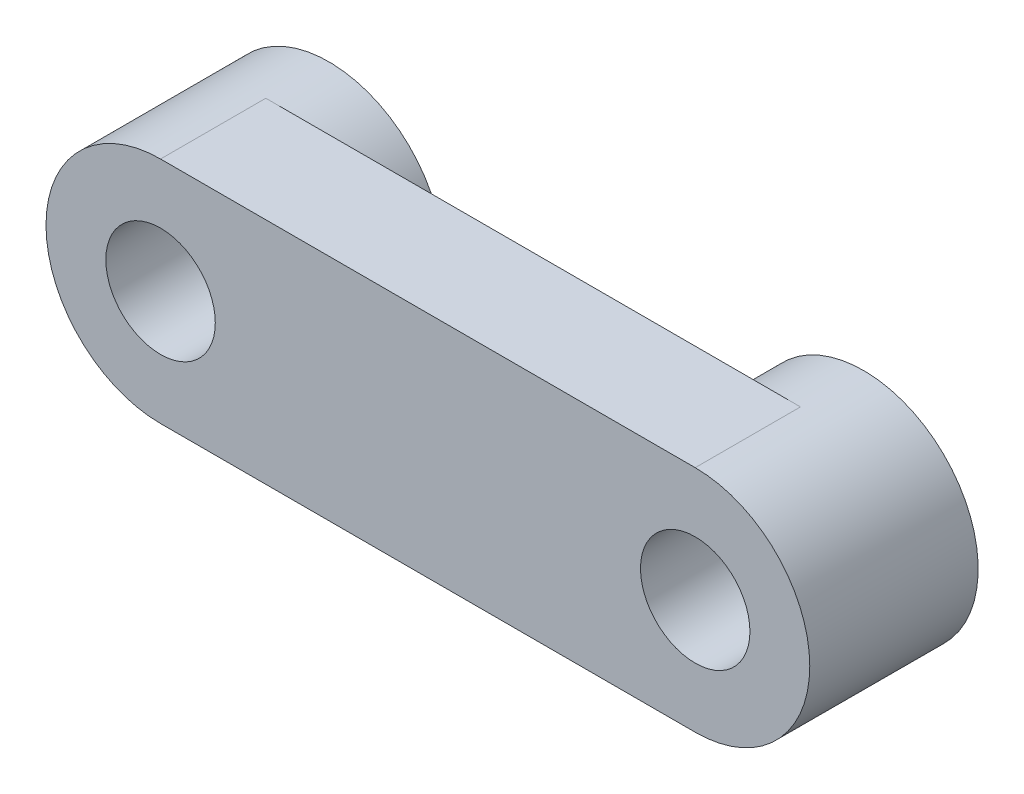
from build123d import *
from build123d.topology import SkipClean

# Parameters (mm, degrees)
SKETCH1_R           = 2.6
BOSS_EXTRUDE1_DEPTH = 5
BOSS_EXTRUDE2_START = 3
SKETCH2_R           = 5.442857143
SKETCH2_R_2         = 2.6
BOSS_EXTRUDE2_DEPTH = 3


with BuildPart() as part:
    # Sketch1 → Boss-Extrude1 (new body)
    with BuildSketch(Plane.XY):
        with BuildLine():
            Line((-12.7, 5.442857143), (12.7, 5.442857143))
            ThreePointArc((12.7, 5.442857143), (18.142857143, 0), (12.7, -5.442857143))
            Line((12.7, -5.442857143), (-12.7, -5.442857143))
            ThreePointArc((-12.7, -5.442857143), (-18.142857143, 0), (-12.7, 5.442857143))
        make_face()
        with Locations((-12.7, 0)):
            Circle(SKETCH1_R, mode=Mode.SUBTRACT)
        with Locations((12.7, 0)):
            Circle(SKETCH1_R, mode=Mode.SUBTRACT)
    extrude(amount=BOSS_EXTRUDE1_DEPTH)

    # Sketch2 → Boss-Extrude2 (add)
    # profile 1 of 2: a face of its own
    with SkipClean():  # the faces are left unmerged after this step: merging them gives an invalid solid
        with BuildSketch(Plane(origin=(0, 0, 0), x_dir=(-1, 0, 0), z_dir=(0, 0, -1)).offset(BOSS_EXTRUDE2_START)):
            with Locations((-12.7, 0)):
                Circle(SKETCH2_R)
            with Locations((-12.7, 0)):
                Circle(SKETCH2_R_2, mode=Mode.SUBTRACT)
        # profile 2 of 2: a face of its own
        with BuildSketch(Plane(origin=(0, 0, 0), x_dir=(-1, 0, 0), z_dir=(0, 0, -1)).offset(BOSS_EXTRUDE2_START)):
            with Locations((12.7, 0)):
                Circle(SKETCH2_R)
            with Locations((12.7, 0)):
                Circle(SKETCH2_R_2, mode=Mode.SUBTRACT)
        extrude(amount=-BOSS_EXTRUDE2_DEPTH)


solid = part.part
